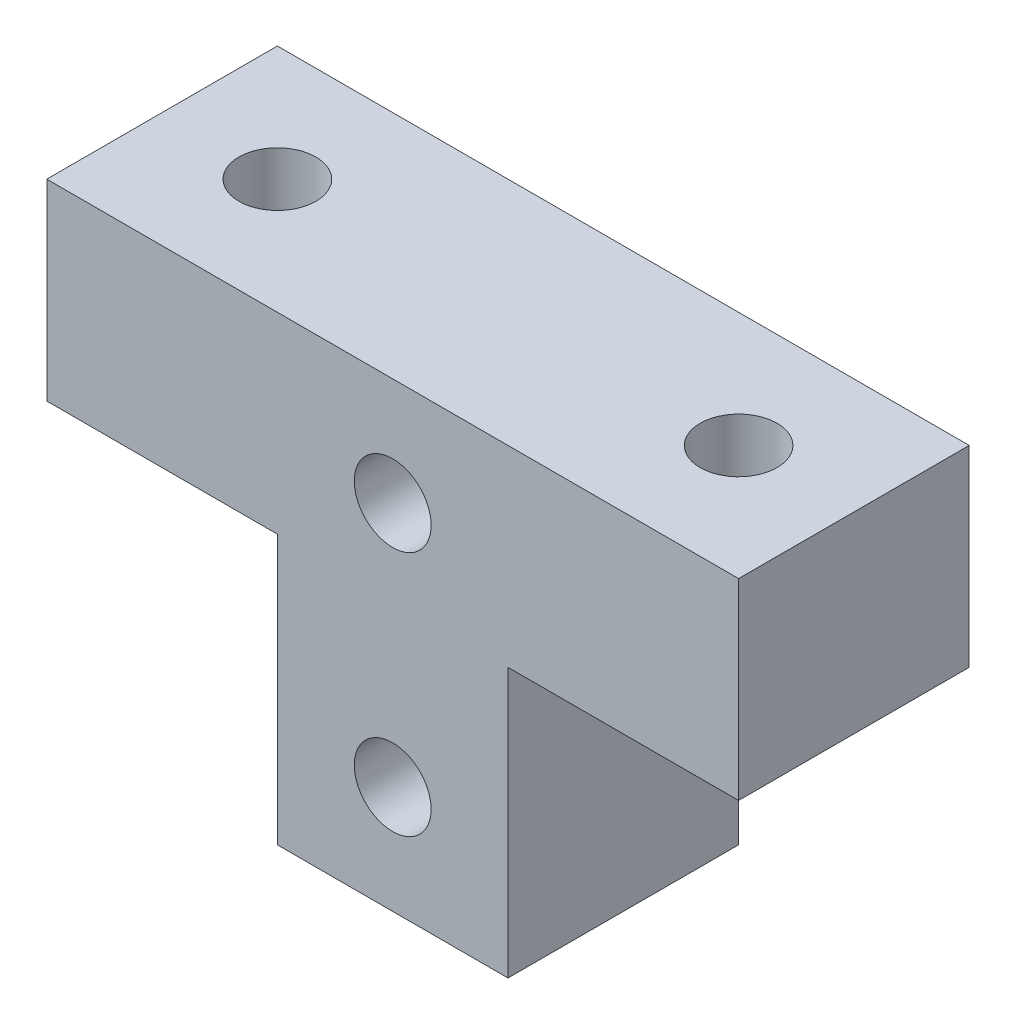
from build123d import *

# Parameters (mm, degrees)
BOSS_EXTRUDE1_DEPTH         = 19.05
F_1_4_0_25_DIAMETER_HOLE1_D = 6.35
F_1_4_0_25_DIAMETER_HOLE2_D = 6.35


with BuildPart() as part:
    # Sketch1 → Boss-Extrude1 (new body)
    with BuildSketch(Plane.XY):
        Polygon((-28.575, 19.05), (28.575, 19.05), (28.575, 3.175), (19.05, 3.175), (9.525, 3.175), (9.525, -19.05), (-9.525, -19.05), (-9.525, 3.175), (-19.05, 3.175), (-28.575, 3.175), align=None)
    extrude(amount=-BOSS_EXTRUDE1_DEPTH)

    # 1/4 (0.25) Diameter Hole1 (through all)
    with Locations(Plane.XY):
        with Locations((0, 10.16), (0, -10.16)):
            Hole(F_1_4_0_25_DIAMETER_HOLE1_D / 2)

    # 1/4 (0.25) Diameter Hole2 (through all)
    with Locations(Plane(origin=(0, 19.05, 0), x_dir=(1, 0, 0), z_dir=(0, 1, 0))):
        with Locations((-19.05, 9.525), (19.05, 9.525)):
            Hole(F_1_4_0_25_DIAMETER_HOLE2_D / 2)


solid = part.part
